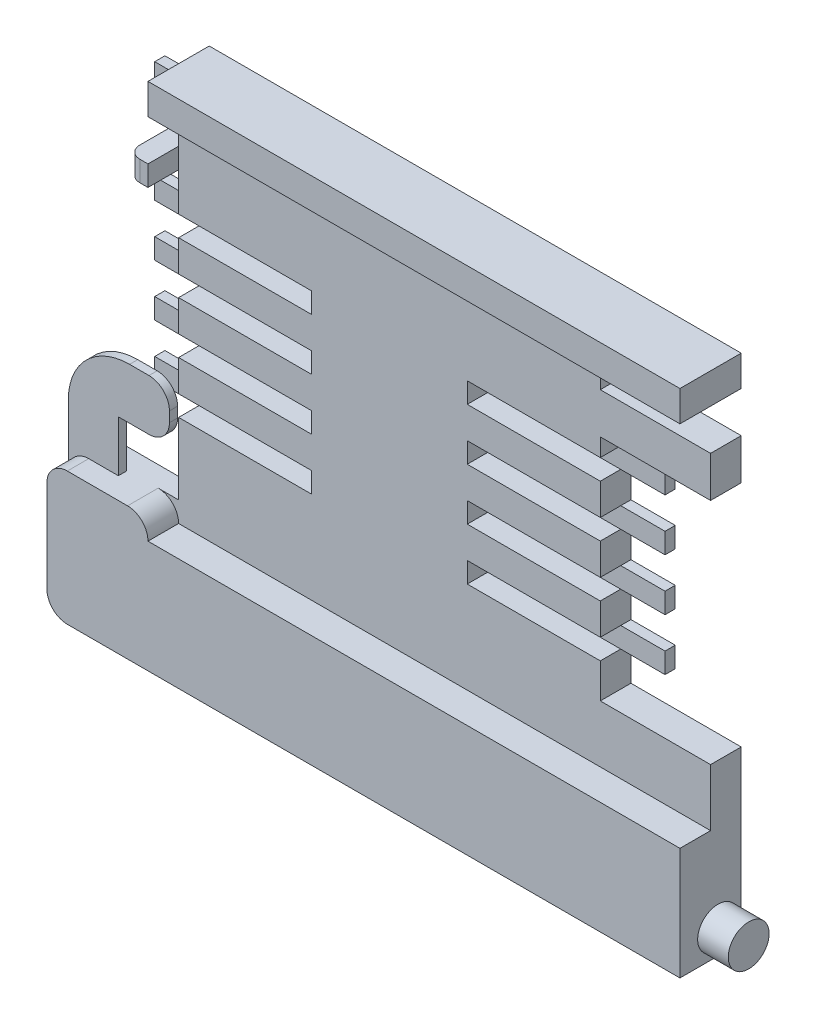
from build123d import *

# Parameters (mm, degrees)
SKETCH_1_W            = 26.05
SKETCH_1_H            = 25
EXTRUDE_1_DEPTH       = 1.5
SKETCH_3_W            = 5.4
SKETCH_3_H            = 11.2
CUT_EXTRUDE_1_DEPTH   = 19.114928236
SKETCH_4_W            = 26.05
SKETCH_4_H            = 1.5
EXTRUDE_2_DEPTH       = 1.5
SKETCH_5_W            = 5.4
SKETCH_5_H            = 2
CUT_EXTRUDE_2_DEPTH   = 19.114928236
SKETCH_6_W            = 31
SKETCH_6_H            = 5.5
EXTRUDE_3_DEPTH       = 1.5
SKETCH_7_R            = 1
EXTRUDE_4_DEPTH       = 1.5
EXTRUDE_13_DEPTH      = 1
EXTRUDE_13_DEPTH_BACK = 1.5
SKETCH_10_W           = 4.95
SKETCH_10_H           = 6.5
FILLET_1_R            = 1
SKETCH_11_W           = 4.95
SKETCH_11_H           = 0.4
EXTRUDE_1_2_DEPTH     = 5
SKETCH_12_W           = 2.5
SKETCH_12_H           = 2.5
CUT_EXTRUDE_3_DEPTH   = 22.980744414
FILLET_2_R            = 3
FILLET_3_R            = 1
SKETCH_13_W           = 1
SKETCH_13_H           = 0.4
EXTRUDE_14_DEPTH      = 4
SKETCH_15_W           = 1.5
SKETCH_15_H           = 1
EXTRUDE_15_DEPTH      = 1
SKETCH_16_W           = 1
SKETCH_16_H           = 1
EXTRUDE_16_DEPTH      = 1.5
SKETCH_17_W           = 6.515
SKETCH_17_H           = 1
CUT_EXTRUDE_1_2_DEPTH = 1
SKETCH_18_W           = 0.5
SKETCH_18_H           = 1
EXTRUDE_17_DEPTH      = 2.17
SKETCH_20_W           = 0.5
SKETCH_20_H           = 1
EXTRUDE_18_DEPTH      = 2.17
SKETCH_21_W           = 6.515
SKETCH_21_H           = 1
SKETCH_21_H_2         = 1.095349757
CUT_EXTRUDE_4_DEPTH   = 1
SKETCH_22_W           = 0.5
SKETCH_22_H           = 1
EXTRUDE_19_DEPTH      = 2.17
SKETCH_23_W           = 0.5
SKETCH_23_H           = 1.095349757
EXTRUDE_20_DEPTH      = 2.17
FILLET_4_R            = 0.6


with BuildPart() as part:
    # Эскиз1 → Extrude 1 (new body)
    with BuildSketch(Plane.XY):
        Rectangle(SKETCH_1_W, SKETCH_1_H)
    extrude(amount=EXTRUDE_1_DEPTH)

    # Эскиз3 → Cut-Extrude 1 (cut, through all)
    with BuildSketch(Plane.XY.offset(1.5)):
        with Locations((10.325, 1.4)):
            Rectangle(SKETCH_3_W, SKETCH_3_H)
    extrude(amount=-CUT_EXTRUDE_1_DEPTH, mode=Mode.SUBTRACT)

    # Эскиз4 → Бобышка-Вытянуть2 (add)
    with BuildSketch(Plane.XY.offset(1.5)):
        with Locations((0, 11.75)):
            Rectangle(SKETCH_4_W, SKETCH_4_H)
    extrude(amount=EXTRUDE_2_DEPTH)

    # Эскиз5 → Вырез-Вытянуть2 (cut, through all)
    with BuildSketch(Plane.XY.offset(1.5)):
        with Locations((10.325, 10)):
            Rectangle(SKETCH_5_W, SKETCH_5_H)
    extrude(amount=-CUT_EXTRUDE_2_DEPTH, mode=Mode.SUBTRACT)

    # Эскиз6 → Бобышка-Вытянуть3 (add)
    with BuildSketch(Plane.XY.offset(1.5)):
        with Locations((-2.475, -9.75)):
            Rectangle(SKETCH_6_W, SKETCH_6_H)
    extrude(amount=EXTRUDE_3_DEPTH)

    # Эскиз7 → Бобышка-Вытянуть4 (add)
    with BuildSketch(Plane(origin=(13.025, 0, 0), x_dir=(0, 0, -1), z_dir=(1, 0, 0))):
        with Locations(Location((-1.132985358, -11.301432667, 0), (0, 0, 180))):
            Circle(SKETCH_7_R)
    extrude(amount=EXTRUDE_4_DEPTH)

    # Эскиз10 → Бобышка-Вытянуть13 (add, two sides: drawn at the far end of the back side and taken through both)
    with BuildSketch(Plane(origin=(0, 0, 1.5), x_dir=(-1, 0, 0), z_dir=(0, 0, -1)).offset(-EXTRUDE_13_DEPTH_BACK)):
        with Locations((15.5, -9.25)):
            Rectangle(SKETCH_10_W, SKETCH_10_H)
    extrude(amount=EXTRUDE_13_DEPTH + EXTRUDE_13_DEPTH_BACK)

    # Скругление1
    fillet_1_edges = [part.edges().sort_by_distance(p)[0] for p in [
        (-17.975, -12.5, 1.75),
        (-17.975, -6, 1.75),
        (-13.025, -6, 2.25),
    ]]
    fillet(fillet_1_edges, radius=FILLET_1_R - 0.0001)  # a hair under: the kernel refuses the full size

    # Эскиз11 → Extrude 1 2 (add)
    with BuildSketch(Plane(origin=(0, -6, 0), x_dir=(1, 0, 0), z_dir=(0, 1, 0))):
        with Locations((-15.5, -1.75)):
            Rectangle(SKETCH_11_W, SKETCH_11_H)
    extrude(amount=EXTRUDE_1_2_DEPTH)

    # Эскиз12 → Вырез-Вытянуть3 (cut, through all)
    with BuildSketch(Plane.XY.offset(1.95)):
        with Locations((-14.275, -4.75)):
            Rectangle(SKETCH_12_W, SKETCH_12_H)
    extrude(amount=-CUT_EXTRUDE_3_DEPTH, mode=Mode.SUBTRACT)

    # Скругление2
    fillet_2_edges = [part.edges().sort_by_distance(p)[0] for p in [
        (-17.975, -1, 1.75),
    ]]
    fillet(fillet_2_edges, radius=FILLET_2_R)

    # Скругление3
    fillet_3_edges = [part.edges().sort_by_distance(p)[0] for p in [
        (-13.025, -1, 1.75),
        (-13.025, -3.5, 1.75),
    ]]
    fillet(fillet_3_edges, radius=FILLET_3_R)

    # Эскиз13 → Бобышка-Вытянуть14 (add)
    with BuildSketch(Plane.XZ.offset(6)):
        with Locations((-17.475, 1.75)):
            Rectangle(SKETCH_13_W, SKETCH_13_H)
    extrude(amount=EXTRUDE_14_DEPTH)

    # Эскиз15 → Бобышка-Вытянуть15 (add)
    with BuildSketch(Plane.ZY.offset(13.025)):
        with Locations((0.75, 8.5)):
            Rectangle(SKETCH_15_W, SKETCH_15_H)
    extrude(amount=EXTRUDE_15_DEPTH)

    # Эскиз16 → Бобышка-Вытянуть16 (add)
    with BuildSketch(Plane.XY.offset(1.5)):
        with Locations((-13.525, 8.5)):
            Rectangle(SKETCH_16_W, SKETCH_16_H)
    extrude(amount=EXTRUDE_16_DEPTH)

    # Эскиз17 → Cut-Extrude 1 2 (cut)
    with BuildSketch(Plane.XY.offset(1.5)):
        with Locations((-9.7675, -2)):
            Rectangle(SKETCH_17_W, SKETCH_17_H)
        with Locations((4.3675, -2)):
            Rectangle(SKETCH_17_W, SKETCH_17_H)
        with Locations((-9.7675, 0.54)):
            Rectangle(SKETCH_17_W, SKETCH_17_H)
        with Locations((4.3675, 0.54)):
            Rectangle(SKETCH_17_W, SKETCH_17_H)
        with Locations((-9.7675, 3.08)):
            Rectangle(SKETCH_17_W, SKETCH_17_H)
        with Locations((4.3675, 3.08)):
            Rectangle(SKETCH_17_W, SKETCH_17_H)
        with Locations((-9.7675, 5.62)):
            Rectangle(SKETCH_17_W, SKETCH_17_H)
        with Locations((4.3675, 5.62)):
            Rectangle(SKETCH_17_W, SKETCH_17_H)
    extrude(amount=-CUT_EXTRUDE_1_2_DEPTH, mode=Mode.SUBTRACT)

    # Эскиз18 → Бобышка-Вытянуть17 (add)
    with BuildSketch(Plane(origin=(7.625, 0, 0), x_dir=(0, 0, -1), z_dir=(1, 0, 0))):
        with Locations((-0.25, 3.08)):
            Rectangle(SKETCH_18_W, SKETCH_18_H)
        with Locations((-0.25, 5.62)):
            Rectangle(SKETCH_18_W, SKETCH_18_H)
        with Locations((-0.25, 0.54)):
            Rectangle(SKETCH_18_W, SKETCH_18_H)
        with Locations((-0.25, -2)):
            Rectangle(SKETCH_18_W, SKETCH_18_H)
    extrude(amount=EXTRUDE_17_DEPTH)

    # Эскиз20 → Бобышка-Вытянуть18 (add)
    with BuildSketch(Plane.ZY.offset(13.025)):
        with Locations((0.25, 3.08)):
            Rectangle(SKETCH_20_W, SKETCH_20_H)
        with Locations((0.25, 5.62)):
            Rectangle(SKETCH_20_W, SKETCH_20_H)
        with Locations((0.25, 0.54)):
            Rectangle(SKETCH_20_W, SKETCH_20_H)
        with Locations((0.25, -2)):
            Rectangle(SKETCH_20_W, SKETCH_20_H)
    extrude(amount=EXTRUDE_18_DEPTH)

    # Эскиз21 → Вырез-Вытянуть4 (cut)
    with BuildSketch(Plane.XY.offset(1.5)):
        with Locations((-9.7675, 10.5)):
            Rectangle(SKETCH_21_W, SKETCH_21_H)
        with Locations((4.3675, 10.452325121)):
            Rectangle(SKETCH_21_W, SKETCH_21_H_2)
    extrude(amount=-CUT_EXTRUDE_4_DEPTH, mode=Mode.SUBTRACT)

    # Эскиз22 → Бобышка-Вытянуть19 (add)
    with BuildSketch(Plane.ZY.offset(13.025)):
        with Locations((0.25, 10.5)):
            Rectangle(SKETCH_22_W, SKETCH_22_H)
    extrude(amount=EXTRUDE_19_DEPTH)

    # Эскиз23 → Бобышка-Вытянуть20 (add)
    with BuildSketch(Plane(origin=(7.625, 0, 0), x_dir=(0, 0, -1), z_dir=(1, 0, 0))):
        with Locations((-0.25, 10.452325121)):
            Rectangle(SKETCH_23_W, SKETCH_23_H)
    extrude(amount=EXTRUDE_20_DEPTH)

    # Скругление4
    fillet_4_edges = [part.edges().sort_by_distance(p)[0] for p in [
        (-14.025, 8.5, 3),
    ]]
    fillet(fillet_4_edges, radius=FILLET_4_R)


solid = part.part
